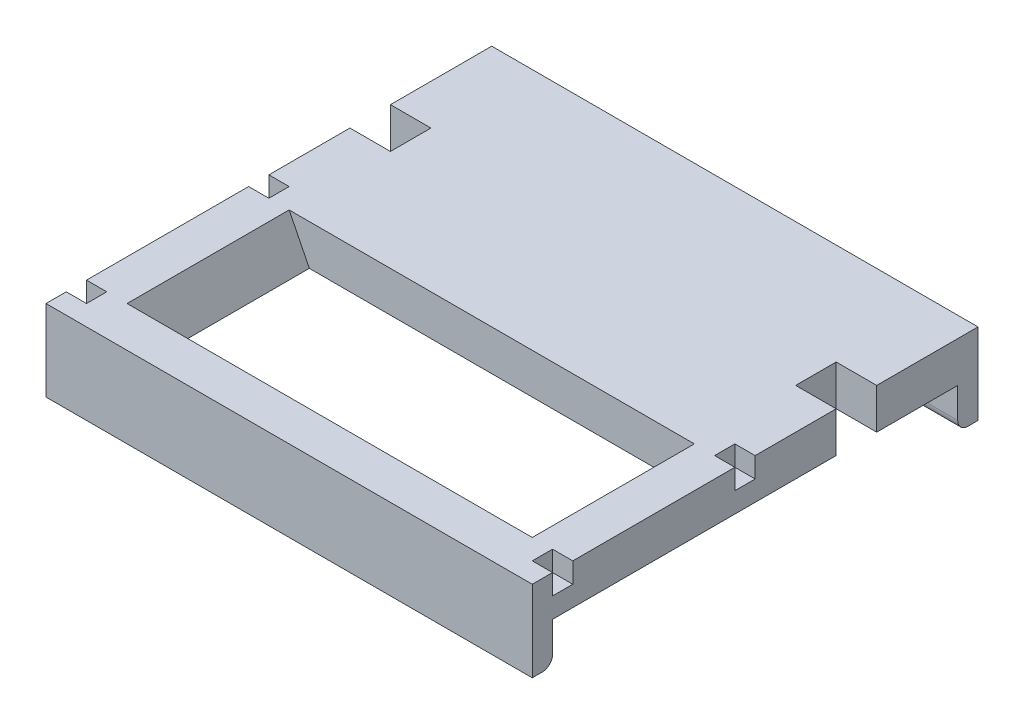
from build123d import *

# Parameters (mm, degrees)
BOSS_EXTRUDE1_DEPTH = 10
CUT_EXTRUDE1_DEPTH  = 10
SKETCH2_3_W         = 3
SKETCH2_3_H         = 3
SKETCH2_3_W_2       = 6
SKETCH2_3_H_2       = 6
CUT_EXTRUDE2_DEPTH  = 6
CHAMFER2_SIZE       = 5
CHAMFER2_SIZE_2     = 10.028448541
CHAMFER3_SIZE2      = 4.999988835
CHAMFER3_SIZE       = 10
SKETCH1_6_W         = 6
SKETCH1_6_H         = 3
SKETCH1_6_W_2       = 10
SKETCH1_6_H_2       = 10
SKETCH1_6_H_3       = 6
CUT_EXTRUDE3_DEPTH  = 10
SKETCH1_7_W         = 5
SKETCH1_7_H         = 5
CUT_EXTRUDE4_DEPTH  = 5
SKETCH5_W           = 120
SKETCH5_H           = 5
BOSS_EXTRUDE3_DEPTH = 20
FILLET2_R           = 2.5


# Some blends are built 0.0001 mm under size
with BuildPart() as part:
    # Sketch1 → Boss-Extrude1 (new body)
    with BuildSketch(Plane(origin=(0, 0, 0), x_dir=(1, 0, 0), z_dir=(0, 1, 0))):
        Polygon((-60, 50), (-60, -2.5), (-60, -50), (0, -50), (60, -50), (60, 50), (0, 50), align=None)
    extrude(amount=-BOSS_EXTRUDE1_DEPTH)

    # Sketch2 → Cut-Extrude1 (cut)
    with BuildSketch(Plane.XZ.offset(10)):
        Polygon((45, 45), (-45, 45), (-45, 5), (-40, 5), (45, 5), (45, 25), align=None)
    extrude(amount=-CUT_EXTRUDE1_DEPTH, mode=Mode.SUBTRACT)

    # Sketch2<3> → Cut-Extrude2 (cut)
    with BuildSketch(Plane.XZ.offset(10)):
        with Locations((47.5, 47.5)):
            Rectangle(SKETCH2_3_W, SKETCH2_3_H)
        with Locations((-47.5, 2.5)):
            Rectangle(SKETCH2_3_W, SKETCH2_3_H)
        with Locations((47.5, 2.5)):
            Rectangle(SKETCH2_3_W, SKETCH2_3_H)
        with Locations((45, -25)):
            Rectangle(SKETCH2_3_W_2, SKETCH2_3_H_2)
        with Locations((-47.5, 47.5)):
            Rectangle(SKETCH2_3_W, SKETCH2_3_H)
        with Locations((-45, -25)):
            Rectangle(SKETCH2_3_W_2, SKETCH2_3_H_2)
    extrude(amount=-CUT_EXTRUDE2_DEPTH, mode=Mode.SUBTRACT)

    # Chamfer2
    # the kernel refuses this chamfer: 10.028448541, 5 mm, written as the material it takes off along each edge
    with BuildSketch(Plane(origin=(-45, 0, 45), x_dir=(-0.9976061957759285, 0.06915112543899754, 0), z_dir=(0, 0, -1))) as chamfer2_piece_1:
        Polygon((CHAMFER2_SIZE * 0.997606195776, -CHAMFER2_SIZE * 0.069151125439), (-CHAMFER2_SIZE_2 * 0.069151125441, -CHAMFER2_SIZE_2 * 0.997606195805), (0, 0), align=None)
    extrude(amount=40, mode=Mode.SUBTRACT)

    # Chamfer3
    chamfer3_edges = [part.edges().sort_by_distance(p)[0] for p in [
        (45, 0, 25),
    ]]
    chamfer3_side = [part.faces().sort_by_distance(p)[0] for p in [
        (45, -0.099999777, 25),
    ]]
    chamfer(chamfer3_edges, length=CHAMFER3_SIZE - 0.0001, length2=CHAMFER3_SIZE2 - 0.0001, reference=chamfer3_side[0])  # a hair under: the kernel refuses the full size

    # Sketch1<6> → Cut-Extrude3 (cut)
    # profile 1 of 6: a face of its own
    with BuildSketch(Plane(origin=(0, 0, 0), x_dir=(1, 0, 0), z_dir=(0, 1, 0))):
        Polygon((-50, 25), (-50, 30), (-60, 30), (-60, 25), (-58, 25), (-58, 28), (-52, 28), (-52, 25), align=None)
    # profile 2 of 6: a face of its own
    with BuildSketch(Plane(origin=(0, 0, 0), x_dir=(1, 0, 0), z_dir=(0, 1, 0))):
        with Locations((-55, 26.5)):
            Rectangle(SKETCH1_6_W, SKETCH1_6_H)
    # profile 3 of 6: a face of its own
    with BuildSketch(Plane(origin=(0, 0, 0), x_dir=(1, 0, 0), z_dir=(0, 1, 0))):
        with Locations((-55, 23.5)):
            Rectangle(SKETCH1_6_W, SKETCH1_6_H)
    # profile 4 of 6: a face of its own
    with BuildSketch(Plane(origin=(0, 0, 0), x_dir=(1, 0, 0), z_dir=(0, 1, 0))):
        Polygon((-50, 20), (-50, 25), (-52, 25), (-52, 22), (-58, 22), (-58, 25), (-60, 25), (-60, 20), (-55, 20), align=None)
    # profile 5 of 6: a face of its own
    with BuildSketch(Plane(origin=(0, 0, 0), x_dir=(1, 0, 0), z_dir=(0, 1, 0))):
        with Locations((55, 25)):
            Rectangle(SKETCH1_6_W_2, SKETCH1_6_H_2)
        with Locations((55, 25)):
            Rectangle(SKETCH1_6_W, SKETCH1_6_H_3, mode=Mode.SUBTRACT)
    # profile 6 of 6: a face of its own
    with BuildSketch(Plane(origin=(0, 0, 0), x_dir=(1, 0, 0), z_dir=(0, 1, 0))):
        with Locations((55, 25)):
            Rectangle(SKETCH1_6_W, SKETCH1_6_H_3)
    extrude(amount=-CUT_EXTRUDE3_DEPTH, mode=Mode.SUBTRACT)

    # Sketch1<7> → Cut-Extrude4 (cut)
    with BuildSketch(Plane(origin=(0, 0, 0), x_dir=(1, 0, 0), z_dir=(0, 1, 0))):
        with Locations((57.5, -2.5)):
            Rectangle(SKETCH1_7_W, SKETCH1_7_H)
        with Locations((57.5, -47.5)):
            Rectangle(SKETCH1_7_W, SKETCH1_7_H)
        with Locations((-57.5, -47.5)):
            Rectangle(SKETCH1_7_W, SKETCH1_7_H)
        Polygon((-55, -5), (-55, 0), (-60, 0), (-60, -2.5), (-60, -5), align=None)
    extrude(amount=-CUT_EXTRUDE4_DEPTH, mode=Mode.SUBTRACT)

    # Sketch5 → Boss-Extrude3 (add)
    with BuildSketch(Plane(origin=(0, 0, 0), x_dir=(1, 0, 0), z_dir=(0, 1, 0))):
        with Locations((0, -52.5)):
            Rectangle(SKETCH5_W, SKETCH5_H)
        with Locations((0, 52.5)):
            Rectangle(SKETCH5_W, SKETCH5_H)
    extrude(amount=-BOSS_EXTRUDE3_DEPTH)

    # Fillet2
    fillet2_edges = [part.edges().sort_by_distance(p)[0] for p in [
        (0, -20, 50),
        (0, -20, -50),
    ]]
    fillet(fillet2_edges, radius=FILLET2_R)


solid = part.part
